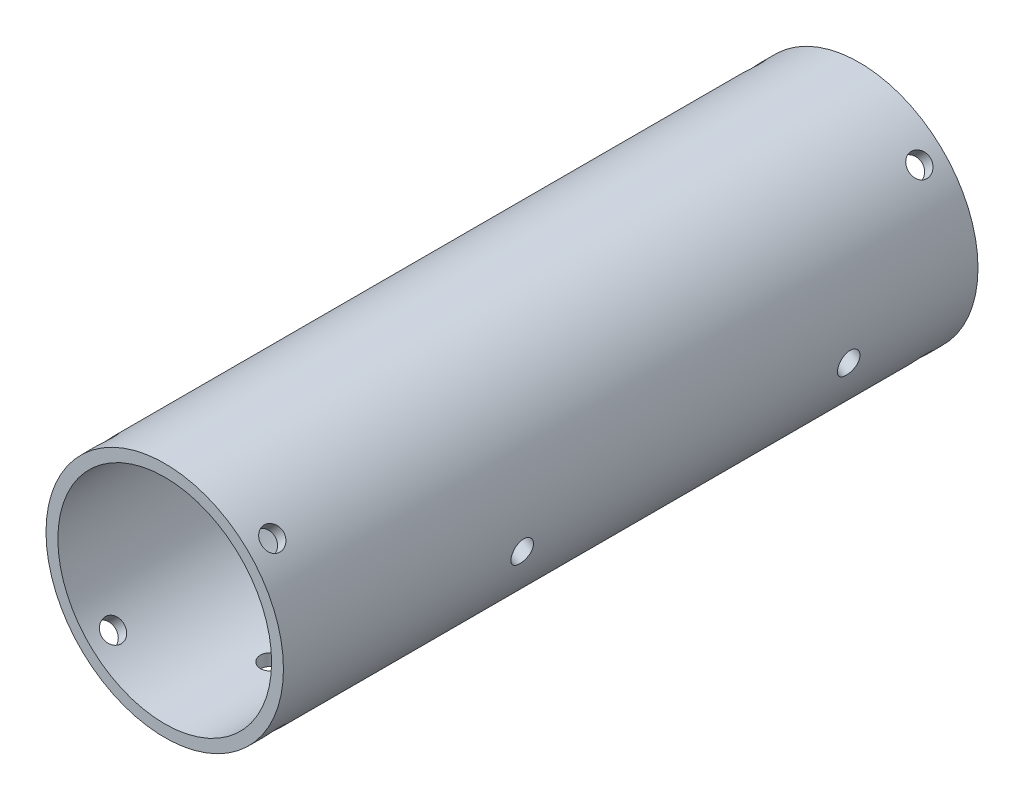
from build123d import *
from build123d.topology import SkipClean

# Parameters (mm, degrees)
SKETCH1_R               = 20
SKETCH1_R_2             = 18
BOSS_EXTRUDE1_DEPTH     = 100
CUT_EXTRUDE1_REACH      = 112.873
CUT_EXTRUDE1_END_RADIUS = 18
SKETCH3_R               = 1.875
SKETCH4_R               = 1.875
CUT_EXTRUDE2_DEPTH      = 23
BOSS_EXTRUDE2_START     = 9
SKETCH5_R               = 20
SKETCH5_R_2             = 18
BOSS_EXTRUDE2_DEPTH     = 9
SKETCH6_R               = 20
SKETCH6_R_2             = 18
BOSS_EXTRUDE3_DEPTH     = 8
CUT_EXTRUDE3_REACH      = 120.302
SKETCH7_R               = 1.875
CIRPATTERN1_COUNT       = 4
MIRROR2_COPY_1_REACH    = 120.302
MIRROR2_COPY_1_SKETCH_R = 1.875
MIRROR2_COPY_2_REACH    = 120.302
MIRROR2_COPY_2_SKETCH_R = 1.875
MIRROR2_COPY_3_REACH    = 120.302
MIRROR2_COPY_3_SKETCH_R = 1.875


with BuildPart() as part:
    # Sketch1 → Boss-Extrude1 (new body)
    with BuildSketch(Plane.XY):
        Circle(SKETCH1_R)
        Circle(SKETCH1_R_2, mode=Mode.SUBTRACT)
    extrude(amount=BOSS_EXTRUDE1_DEPTH)

    # Cut-Extrude1: up to this cylinder (the profile starts outside it)
    cut_extrude1_end = Plane(origin=(0, 0, 40), z_dir=(0, 0, -1)) * Cylinder(CUT_EXTRUDE1_END_RADIUS, 317.746, mode=Mode.PRIVATE)
    # Sketch3 → Cut-Extrude1 (cut, up to the surface)
    with BuildSketch(Plane(origin=(-17.320508076, -10, 0), x_dir=(0, 0, -1), z_dir=(-0.8660254037844398, -0.499999999999998, 0)), mode=Mode.PRIVATE) as cut_extrude1_sk1:
        with Locations((-67.5, -7)):
            Circle(SKETCH3_R)
    cut_extrude1_tool1 = extrude(cut_extrude1_sk1.sketch, amount=-CUT_EXTRUDE1_REACH, mode=Mode.PRIVATE) - cut_extrude1_end
    # Sketch3 → Cut-Extrude1 (cut, up to the surface)
    with BuildSketch(Plane(origin=(-17.320508076, -10, 0), x_dir=(0, 0, -1), z_dir=(-0.8660254037844398, -0.499999999999998, 0)), mode=Mode.PRIVATE) as cut_extrude1_sk2:
        with Locations((-12.5, -7)):
            Circle(SKETCH3_R)
    cut_extrude1_tool2 = extrude(cut_extrude1_sk2.sketch, amount=-CUT_EXTRUDE1_REACH, mode=Mode.PRIVATE) - cut_extrude1_end
    cut_extrude1 = cut_extrude1_tool1.solids().sort_by_distance((-20.820508, -3.937822, 67.5))[0] + cut_extrude1_tool2.solids().sort_by_distance((-20.820508, -3.937822, 12.5))[0]
    add(cut_extrude1, mode=Mode.SUBTRACT)

    # Mirror1: Cut-Extrude1 across plane
    add(cut_extrude1.mirror(Plane(origin=(0, 0, 0), x_dir=(0, 0, 1), z_dir=(1, 0, 0))), mode=Mode.SUBTRACT)

    # Sketch4 → Cut-Extrude2 (cut)
    with BuildSketch(Plane(origin=(0, 0, 0), x_dir=(1, 0, 0), z_dir=(0, 1, 0))):
        with Locations((0, -90)):
            Circle(SKETCH4_R)
    extrude(amount=-CUT_EXTRUDE2_DEPTH, mode=Mode.SUBTRACT)

    # Sketch5 → Boss-Extrude2 (add)
    with BuildSketch(Plane(origin=(0, 0, 0), x_dir=(-1, 0, 0), z_dir=(0, 0, -1)).offset(BOSS_EXTRUDE2_START)):
        Circle(SKETCH5_R)
        Circle(SKETCH5_R_2, mode=Mode.SUBTRACT)
    extrude(amount=-BOSS_EXTRUDE2_DEPTH)

    # Sketch6 → Boss-Extrude3 (add)
    with SkipClean():  # the faces are left unmerged after this step: merging them gives an invalid solid
        with BuildSketch(Plane.XY.offset(100)):
            Circle(SKETCH6_R)
            Circle(SKETCH6_R_2, mode=Mode.SUBTRACT)
        extrude(amount=BOSS_EXTRUDE3_DEPTH)

    # Sketch7 → Cut-Extrude3 (cut, up to next)
    with BuildSketch(Plane(origin=(-14.142135624, -14.142135624, 0), x_dir=(0, 0, -1), z_dir=(-0.7071067811865488, -0.7071067811865464, 0)), mode=Mode.PRIVATE) as cut_extrude3_sk1:
        with Locations((-104, 0)):
            Circle(SKETCH7_R)
    cut_extrude3_tool1 = extrude(cut_extrude3_sk1.sketch, amount=-CUT_EXTRUDE3_REACH, mode=Mode.PRIVATE) & part.part
    cut_extrude3 = cut_extrude3_tool1.solids().sort_by_distance((-14.142136, -14.142136, 104))[0]
    add(cut_extrude3, mode=Mode.SUBTRACT)

    # CirPattern1: Cut-Extrude3 ×4 about axis
    with SkipClean():  # the faces are left unmerged after this step: merging them gives an invalid solid
        cirpattern1_axis = Axis((0, 0, 100), (0, 0, -1))
        for i in range(1, CIRPATTERN1_COUNT):
            add(cut_extrude3.rotate(cirpattern1_axis, i * 360 / CIRPATTERN1_COUNT), mode=Mode.SUBTRACT)

    # Mirror2: Cut-Extrude3 across plane
    with SkipClean():  # the faces are left unmerged after this step: merging them gives an invalid solid
        add(cut_extrude3.mirror(Plane.XY.offset(49.5)), mode=Mode.SUBTRACT)

    # Mirror2 copy 1 sketch → Mirror2 copy 1 (cut, up to next)
    with BuildSketch(Plane(origin=(-14.142135624, 14.142135624, 99), x_dir=(0, 0, 1), z_dir=(-0.7071067811865464, 0.7071067811865488, 0)), mode=Mode.PRIVATE) as mirror2_copy_1_sk1:
        with Locations((-104, 0)):
            Circle(MIRROR2_COPY_1_SKETCH_R)
    mirror2_copy_1_tool1 = extrude(mirror2_copy_1_sk1.sketch, amount=-MIRROR2_COPY_1_REACH, mode=Mode.PRIVATE) & part.part
    add(mirror2_copy_1_tool1.solids().sort_by_distance((-14.142136, 14.142136, -5))[0], mode=Mode.SUBTRACT)

    # Mirror2 copy 2 sketch → Mirror2 copy 2 (cut, up to next)
    with BuildSketch(Plane(origin=(14.142135624, 14.142135624, 99), x_dir=(0, 0, 1), z_dir=(0.7071067811865487, 0.7071067811865465, 0)), mode=Mode.PRIVATE) as mirror2_copy_2_sk1:
        with Locations((-104, 0)):
            Circle(MIRROR2_COPY_2_SKETCH_R)
    mirror2_copy_2_tool1 = extrude(mirror2_copy_2_sk1.sketch, amount=-MIRROR2_COPY_2_REACH, mode=Mode.PRIVATE) & part.part
    add(mirror2_copy_2_tool1.solids().sort_by_distance((14.142136, 14.142136, -5))[0], mode=Mode.SUBTRACT)

    # Mirror2 copy 3 sketch → Mirror2 copy 3 (cut, up to next)
    with BuildSketch(Plane(origin=(14.142135624, -14.142135624, 99), x_dir=(0, 0, 1), z_dir=(0.7071067811865465, -0.7071067811865487, 0)), mode=Mode.PRIVATE) as mirror2_copy_3_sk1:
        with Locations((-104, 0)):
            Circle(MIRROR2_COPY_3_SKETCH_R)
    mirror2_copy_3_tool1 = extrude(mirror2_copy_3_sk1.sketch, amount=-MIRROR2_COPY_3_REACH, mode=Mode.PRIVATE) & part.part
    add(mirror2_copy_3_tool1.solids().sort_by_distance((14.142136, -14.142136, -5))[0], mode=Mode.SUBTRACT)


solid = part.part
